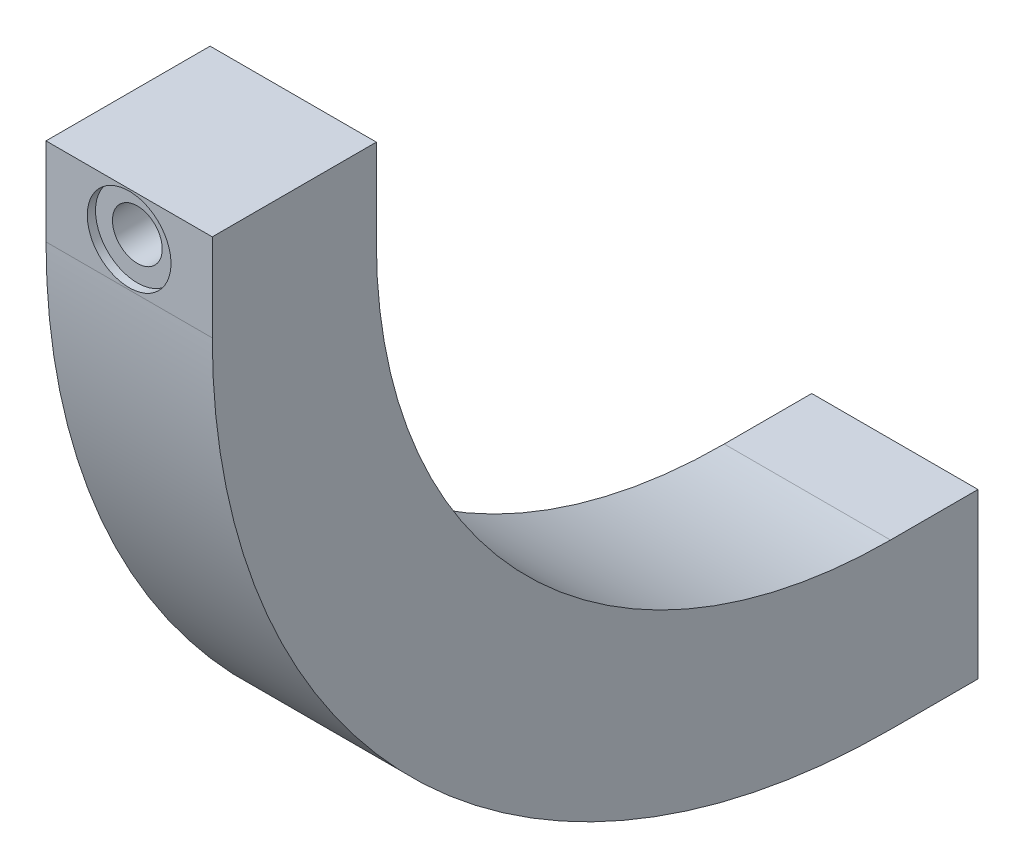
from build123d import *

# Parameters (mm, degrees)
BOSS_EXTRUDE1_DEPTH      = 7.6
BOSS_EXTRUDE1_DEPTH_BACK = 7.6
SKETCH7_R                = 1.75
CUT_EXTRUDE1_DEPTH       = 94.646996748
SKETCH12_R               = 2.275
CUT_EXTRUDE7_DEPTH       = 6
SKETCH14_R               = 3.825
CUT_EXTRUDE10_DEPTH      = 0.75
SKETCH15_R               = 1.5
CUT_EXTRUDE11_DEPTH      = 6


with BuildPart() as part:
    # Sketch5 → Boss-Extrude1 (new, two sides: drawn at the far end of the back side and taken through both)
    with BuildSketch(Plane(origin=(0, 0, 0), x_dir=(0, 0, -1), z_dir=(1, 0, 0)).offset(-BOSS_EXTRUDE1_DEPTH_BACK)):
        with BuildLine():
            Line((-51, 4), (-51, 0))
            Line((-51, 0), (-51, -4))
            ThreePointArc((-51, -4), (-37.234018716, -37.234018716), (-4, -51))
            Line((-4, -51), (0, -51))
            Line((0, -51), (4, -51))
            Line((4, -51), (4, -66))
            Line((4, -66), (-4, -66))
            ThreePointArc((-4, -66), (-47.840620434, -47.840620434), (-66, -4))
            Line((-66, -4), (-66, 4))
            Line((-66, 4), (-51, 4))
        make_face()
    extrude(amount=BOSS_EXTRUDE1_DEPTH + BOSS_EXTRUDE1_DEPTH_BACK)

    # Sketch7 → Cut-Extrude1 (cut, through all)
    with BuildSketch(Plane.XY):
        Circle(SKETCH7_R)
    extrude(amount=CUT_EXTRUDE1_DEPTH, mode=Mode.SUBTRACT)

    # Sketch12 → Cut-Extrude7 (cut)
    with BuildSketch(Plane.XY.offset(66)):
        Circle(SKETCH12_R)
    extrude(amount=-CUT_EXTRUDE7_DEPTH, mode=Mode.SUBTRACT)

    # Sketch14 → Cut-Extrude10 (cut)
    with BuildSketch(Plane(origin=(0, 0, 66), x_dir=(1, 0, 0), z_dir=(0, 0, -1))):
        Circle(SKETCH14_R)
    extrude(amount=CUT_EXTRUDE10_DEPTH, mode=Mode.SUBTRACT)

    # Sketch15 → Cut-Extrude11 (cut)
    with BuildSketch(Plane.XZ.offset(66)):
        Circle(SKETCH15_R)
    extrude(amount=-CUT_EXTRUDE11_DEPTH, mode=Mode.SUBTRACT)


solid = part.part
